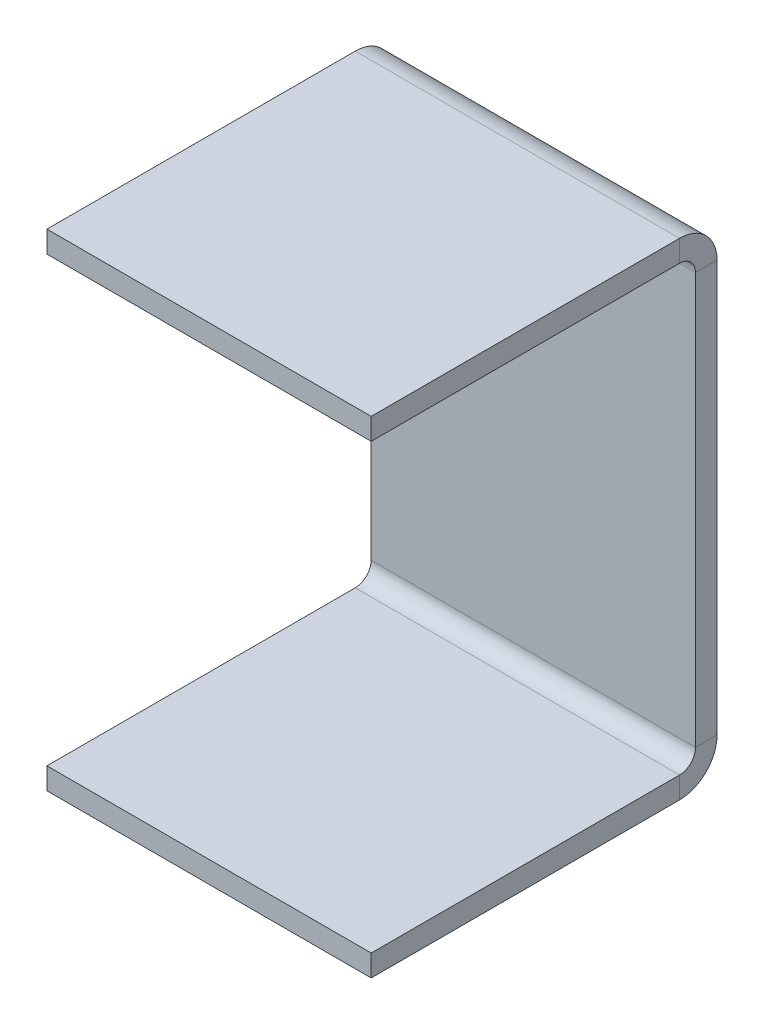
from build123d import *

# Parameters (mm, degrees)
SKETCH1_W                    = 15
SKETCH1_H                    = 20
BASE_FLANGE1_DEPTH           = 1
EDGE_FLANGE1_STRIP_W         = 5.7232
EDGE_FLANGE1_STRIP_H         = 1
EDGE_FLANGE1_STRIP_CUT_DEPTH = 15
EDGE_FLANGE1_DEPTH           = 15
EDGE_FLANGE2_STRIP_W         = 5.7232
EDGE_FLANGE2_STRIP_H         = 1
EDGE_FLANGE2_STRIP_CUT_DEPTH = 15
EDGE_FLANGE2_DEPTH           = 15


# Sheet-metal steps are written as plain solids
with BuildPart() as part:
    # Sketch1 → Base-Flange1 (new body)
    with BuildSketch(Plane.XY):
        Rectangle(SKETCH1_W, SKETCH1_H)
    extrude(amount=-BASE_FLANGE1_DEPTH)

    # Edge-Flange1 strip (across the edge) → Edge-Flange1 strip cut (cut)
    with BuildSketch(Plane(origin=(7.5, 10.25, 0), x_dir=(0, -1, 0), z_dir=(-1, 0, 0))):
        with Locations((-2.125, -0.5)):
            Rectangle(EDGE_FLANGE1_STRIP_W, EDGE_FLANGE1_STRIP_H)
    extrude(amount=EDGE_FLANGE1_STRIP_CUT_DEPTH, mode=Mode.SUBTRACT)

    # Edge-Flange1 section (across the edge) → Edge-Flange1 (add)
    with BuildSketch(Plane(origin=(7.5, 10.25, 0), x_dir=(0, -1, 0), z_dir=(-1, 0, 0))):
        with BuildLine():
            Line((-1, 0.7366), (-1, 15))
            Line((-1, 15), (0, 15))
            Line((0, 15), (0, 0.7366))
            ThreePointArc((0, 0.7366), (0.215745145, 0.215745145), (0.7366, 0))
            Line((0.7366, 0), (0.7366, -1))
            ThreePointArc((0.7366, -1), (-0.491361636, -0.491361636), (-1, 0.7366))
        make_face()
    extrude(amount=EDGE_FLANGE1_DEPTH)

    # Edge-Flange2 strip (across the edge) → Edge-Flange2 strip cut (cut)
    with BuildSketch(Plane(origin=(-7.5, -10.25, 0), x_dir=(0, 1, 0), z_dir=(1, 0, 0))):
        with Locations((-2.125, -0.5)):
            Rectangle(EDGE_FLANGE2_STRIP_W, EDGE_FLANGE2_STRIP_H)
    extrude(amount=EDGE_FLANGE2_STRIP_CUT_DEPTH, mode=Mode.SUBTRACT)

    # Edge-Flange2 section (across the edge) → Edge-Flange2 (add)
    with BuildSketch(Plane(origin=(-7.5, -10.25, 0), x_dir=(0, 1, 0), z_dir=(1, 0, 0))):
        with BuildLine():
            Line((-1, 0.7366), (-1, 15))
            Line((-1, 15), (0, 15))
            Line((0, 15), (0, 0.7366))
            ThreePointArc((0, 0.7366), (0.215745145, 0.215745145), (0.7366, 0))
            Line((0.7366, 0), (0.7366, -1))
            ThreePointArc((0.7366, -1), (-0.491361636, -0.491361636), (-1, 0.7366))
        make_face()
    extrude(amount=EDGE_FLANGE2_DEPTH)


solid = part.part
